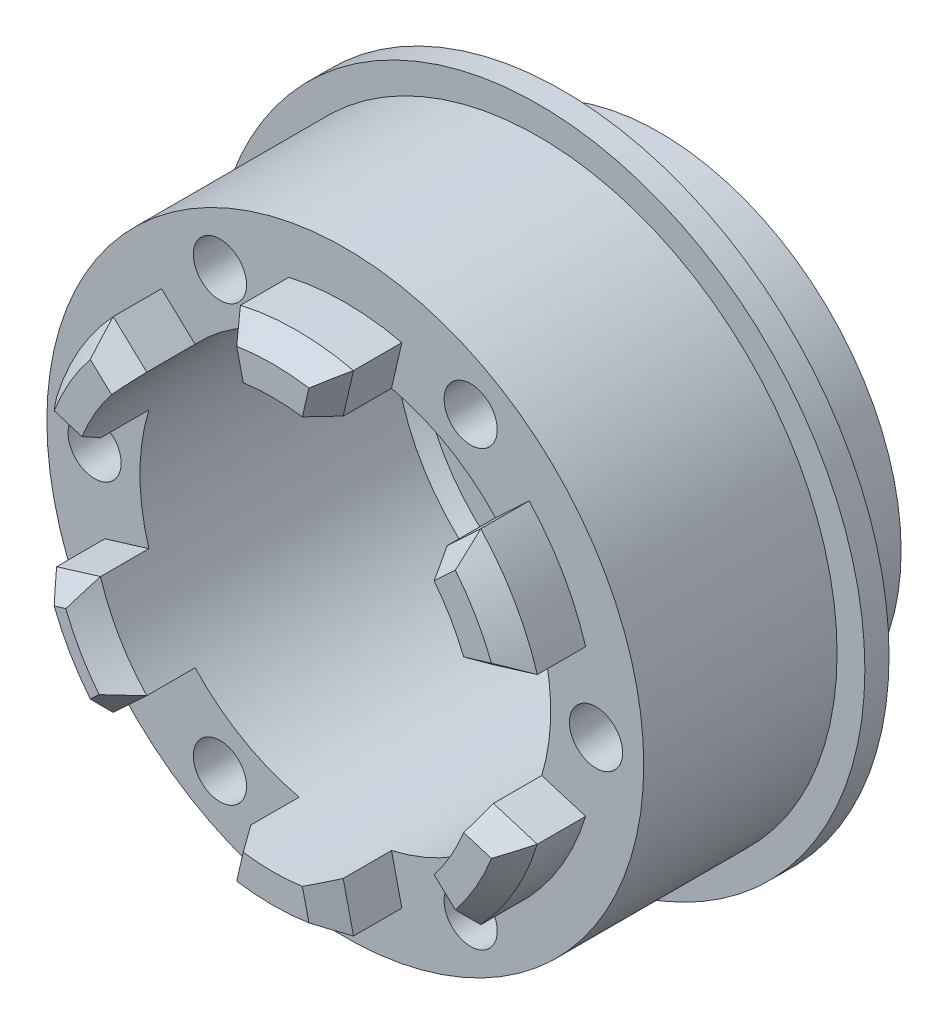
from build123d import *
from OCP.BRepFilletAPI import BRepFilletAPI_MakeChamfer
from build123d.topology import SkipClean

# Parameters (mm, degrees)
SKETCH_1_R          = 10
EXTRUDE_1_DEPTH     = 2
SKETCH_2_R          = 10
SKETCH_2_R_2        = 8.5
EXTRUDE_2_DEPTH     = 2
SKETCH_4_R          = 13.5
SKETCH_4_R_2        = 8.5
EXTRUDE_3_DEPTH     = 1
SKETCH_5_R          = 12.35
SKETCH_5_R_2        = 8.5
EXTRUDE_4_DEPTH     = 8
SKETCH_6_R          = 1.1
CUT_EXTRUDE_1_DEPTH = 8
SKETCH_7_R          = 3
SKETCH_7_R_2        = 1.15
CUT_EXTRUDE_2_DEPTH = 24.097618925
EXTRUDE_5_DEPTH     = 3
CHAMFER_1_SIZE      = 1
CHAMFER_1_SIZE2     = 0.700207538
CHAMFER_2_SIZE      = 0.5


with BuildPart() as part:
    # 스케치1 → 보스-돌출1 (new body)
    with BuildSketch(Plane.XY):
        Circle(SKETCH_1_R)
    extrude(amount=EXTRUDE_1_DEPTH)

    # 스케치2 → 보스-돌출2 (add)
    with BuildSketch(Plane.XY.offset(2)):
        Circle(SKETCH_2_R)
        Circle(SKETCH_2_R_2, mode=Mode.SUBTRACT)
    extrude(amount=EXTRUDE_2_DEPTH)

    # 스케치4 → 보스-돌출3 (add)
    with BuildSketch(Plane.XY.offset(4)):
        Circle(SKETCH_4_R)
        Circle(SKETCH_4_R_2, mode=Mode.SUBTRACT)
    extrude(amount=EXTRUDE_3_DEPTH)

    # 스케치5 → 보스-돌출4 (add)
    with BuildSketch(Plane.XY.offset(5)):
        Circle(SKETCH_5_R)
        Circle(SKETCH_5_R_2, mode=Mode.SUBTRACT)
    extrude(amount=EXTRUDE_4_DEPTH)

    # 스케치6 → 컷-돌출1 (cut)
    with BuildSketch(Plane.XY.offset(13)):
        with Locations((10.375, 0)):
            Circle(SKETCH_6_R)
        with Locations((5.1875, -8.985013564)):
            Circle(SKETCH_6_R)
        with Locations((-5.1875, -8.985013564)):
            Circle(SKETCH_6_R)
        with Locations((-10.375, 0)):
            Circle(SKETCH_6_R)
        with Locations((-5.1875, 8.985013564)):
            Circle(SKETCH_6_R)
        with Locations((5.1875, 8.985013564)):
            Circle(SKETCH_6_R)
    extrude(amount=-CUT_EXTRUDE_1_DEPTH, mode=Mode.SUBTRACT)

    # 스케치7 → 컷-돌출2 (cut, through all)
    with BuildSketch(Plane(origin=(0, 0, 0), x_dir=(-1, 0, 0), z_dir=(0, 0, -1))):
        Circle(SKETCH_7_R)
        with Locations((-7, 0)):
            Circle(SKETCH_7_R_2)
        with Locations((7, 0)):
            Circle(SKETCH_7_R_2)
        with Locations((0, 7)):
            Circle(SKETCH_7_R_2)
        with Locations((0, -7)):
            Circle(SKETCH_7_R_2)
    extrude(amount=-CUT_EXTRUDE_2_DEPTH, mode=Mode.SUBTRACT)

    # 스케치10 → 보스-돌출5 (add)
    with SkipClean():  # the faces are left unmerged after this step: merging them gives an invalid solid
        with BuildSketch(Plane.XY.offset(13)):
            with BuildLine():
                Line((2.339490965, 10.133448674), (1.912083962, 8.282145551))
                ThreePointArc((1.912083962, 8.282145551), (0, 8.5), (-1.912083962, 8.282145551))
                Line((-1.912083962, 8.282145551), (-2.339490965, 10.133448674))
                ThreePointArc((-2.339490965, 10.133448674), (0, 10.4), (2.339490965, 10.133448674))
            make_face()
            with BuildLine():
                Line((7.606078497, 7.092782945), (6.216506464, 5.796986061))
                ThreePointArc((6.216506464, 5.796986061), (7.361215932, 4.25), (8.128590426, 2.48515949))
                Line((8.128590426, 2.48515949), (9.945569462, 3.040665729))
                ThreePointArc((9.945569462, 3.040665729), (9.006664199, 5.2), (7.606078497, 7.092782945))
            make_face()
            with BuildLine():
                Line((9.945569462, -3.040665729), (8.128590426, -2.48515949))
                ThreePointArc((8.128590426, -2.48515949), (7.361215932, -4.25), (6.216506464, -5.796986061))
                Line((6.216506464, -5.796986061), (7.606078497, -7.092782945))
                ThreePointArc((7.606078497, -7.092782945), (9.006664199, -5.2), (9.945569462, -3.040665729))
            make_face()
            with BuildLine():
                Line((2.339490965, -10.133448674), (1.912083962, -8.282145551))
                ThreePointArc((1.912083962, -8.282145551), (0, -8.5), (-1.912083962, -8.282145551))
                Line((-1.912083962, -8.282145551), (-2.339490965, -10.133448674))
                ThreePointArc((-2.339490965, -10.133448674), (0, -10.4), (2.339490965, -10.133448674))
            make_face()
            with BuildLine():
                Line((-7.606078497, -7.092782945), (-6.216506464, -5.796986061))
                ThreePointArc((-6.216506464, -5.796986061), (-7.361215932, -4.25), (-8.128590426, -2.48515949))
                Line((-8.128590426, -2.48515949), (-9.945569462, -3.040665729))
                ThreePointArc((-9.945569462, -3.040665729), (-9.006664199, -5.2), (-7.606078497, -7.092782945))
            make_face()
            with BuildLine():
                Line((-9.945569462, 3.040665729), (-8.128590426, 2.48515949))
                ThreePointArc((-8.128590426, 2.48515949), (-7.361215932, 4.25), (-6.216506464, 5.796986061))
                Line((-6.216506464, 5.796986061), (-7.606078497, 7.092782945))
                ThreePointArc((-7.606078497, 7.092782945), (-9.006664199, 5.2), (-9.945569462, 3.040665729))
            make_face()
        extrude(amount=EXTRUDE_5_DEPTH)

    # 모따기1: one chamfer whose edges measure the first distance from different faces: ONE call of the kernel's chamfer builder (chamfer() names one face for all edges)
    chamfer_1_edges_1 = [part.edges().sort_by_distance(p)[0] for p in [
        (-9.006664199, -5.2, 16),
    ]]
    chamfer_1_side_1 = [part.faces().sort_by_distance(p)[0] for p in [
        (-9.006664199, -5.2, 14.5),
    ]]
    chamfer_1_edges_2 = [part.edges().sort_by_distance(p)[0] for p in [
        (0, -10.4, 16),
    ]]
    chamfer_1_side_2 = [part.faces().sort_by_distance(p)[0] for p in [
        (0, -10.4, 14.5),
    ]]
    chamfer_1_edges_3 = [part.edges().sort_by_distance(p)[0] for p in [
        (9.006664199, -5.2, 16),
    ]]
    chamfer_1_side_3 = [part.faces().sort_by_distance(p)[0] for p in [
        (9.006664199, -5.2, 14.5),
    ]]
    chamfer_1_edges_4 = [part.edges().sort_by_distance(p)[0] for p in [
        (9.006664199, 5.2, 16),
    ]]
    chamfer_1_side_4 = [part.faces().sort_by_distance(p)[0] for p in [
        (9.006664199, 5.2, 14.5),
    ]]
    chamfer_1_edges_5 = [part.edges().sort_by_distance(p)[0] for p in [
        (0, 10.4, 16),
    ]]
    chamfer_1_side_5 = [part.faces().sort_by_distance(p)[0] for p in [
        (0, 10.4, 14.5),
    ]]
    chamfer_1_edges_6 = [part.edges().sort_by_distance(p)[0] for p in [
        (-9.006664199, 5.2, 16),
    ]]
    chamfer_1_side_6 = [part.faces().sort_by_distance(p)[0] for p in [
        (-9.006664199, 5.2, 14.5),
    ]]
    chamfer_1_edges_7 = [part.edges().sort_by_distance(p)[0] for p in [
        (-9.037079944, -2.76291261, 16),
    ]]
    chamfer_1_side_7 = [part.faces().sort_by_distance(p)[0] for p in [
        (-9.037079944, -2.76291261, 14.5),
    ]]
    chamfer_1_edges_8 = [part.edges().sort_by_distance(p)[0] for p in [
        (-7.361215932, -4.25, 16),
    ]]
    chamfer_1_side_8 = [part.faces().sort_by_distance(p)[0] for p in [
        (-7.361215932, -4.25, 14.5),
    ]]
    chamfer_1_edges_9 = [part.edges().sort_by_distance(p)[0] for p in [
        (-6.91129248, -6.444884503, 16),
    ]]
    chamfer_1_side_9 = [part.faces().sort_by_distance(p)[0] for p in [
        (-6.91129248, -6.444884503, 14.5),
    ]]
    chamfer_1_edges_10 = [part.edges().sort_by_distance(p)[0] for p in [
        (2.125787464, -9.207797112, 16),
    ]]
    chamfer_1_side_10 = [part.faces().sort_by_distance(p)[0] for p in [
        (2.125787464, -9.207797112, 14.5),
    ]]
    chamfer_1_edges_11 = [part.edges().sort_by_distance(p)[0] for p in [
        (-2.125787464, -9.207797112, 16),
    ]]
    chamfer_1_side_11 = [part.faces().sort_by_distance(p)[0] for p in [
        (-2.125787464, -9.207797112, 14.5),
    ]]
    chamfer_1_edges_12 = [part.edges().sort_by_distance(p)[0] for p in [
        (6.91129248, -6.444884503, 16),
    ]]
    chamfer_1_side_12 = [part.faces().sort_by_distance(p)[0] for p in [
        (6.91129248, -6.444884503, 14.5),
    ]]
    chamfer_1_edges_13 = [part.edges().sort_by_distance(p)[0] for p in [
        (9.037079944, -2.76291261, 16),
    ]]
    chamfer_1_side_13 = [part.faces().sort_by_distance(p)[0] for p in [
        (9.037079944, -2.76291261, 14.5),
    ]]
    chamfer_1_edges_14 = [part.edges().sort_by_distance(p)[0] for p in [
        (9.037079944, 2.76291261, 16),
    ]]
    chamfer_1_side_14 = [part.faces().sort_by_distance(p)[0] for p in [
        (9.037079944, 2.76291261, 14.5),
    ]]
    chamfer_1_edges_15 = [part.edges().sort_by_distance(p)[0] for p in [
        (6.91129248, 6.444884503, 16),
    ]]
    chamfer_1_side_15 = [part.faces().sort_by_distance(p)[0] for p in [
        (6.91129248, 6.444884503, 14.5),
    ]]
    chamfer_1_edges_16 = [part.edges().sort_by_distance(p)[0] for p in [
        (2.125787464, 9.207797112, 16),
    ]]
    chamfer_1_side_16 = [part.faces().sort_by_distance(p)[0] for p in [
        (2.125787464, 9.207797112, 14.5),
    ]]
    chamfer_1_edges_17 = [part.edges().sort_by_distance(p)[0] for p in [
        (-2.125787464, 9.207797112, 16),
    ]]
    chamfer_1_side_17 = [part.faces().sort_by_distance(p)[0] for p in [
        (-2.125787464, 9.207797112, 14.5),
    ]]
    chamfer_1_edges_18 = [part.edges().sort_by_distance(p)[0] for p in [
        (-9.037079944, 2.76291261, 16),
    ]]
    chamfer_1_side_18 = [part.faces().sort_by_distance(p)[0] for p in [
        (-9.037079944, 2.76291261, 14.5),
    ]]
    chamfer_1_edges_19 = [part.edges().sort_by_distance(p)[0] for p in [
        (-6.91129248, 6.444884503, 16),
    ]]
    chamfer_1_side_19 = [part.faces().sort_by_distance(p)[0] for p in [
        (-6.91129248, 6.444884503, 14.5),
    ]]
    chamfer_1 = BRepFilletAPI_MakeChamfer(part.part.solid().wrapped)
    for e in chamfer_1_edges_1:
        chamfer_1.Add(CHAMFER_1_SIZE, CHAMFER_1_SIZE2, e.wrapped, chamfer_1_side_1[0].wrapped)  # the first distance lies on this face
    for e in chamfer_1_edges_2:
        chamfer_1.Add(CHAMFER_1_SIZE, CHAMFER_1_SIZE2, e.wrapped, chamfer_1_side_2[0].wrapped)  # the first distance lies on this face
    for e in chamfer_1_edges_3:
        chamfer_1.Add(CHAMFER_1_SIZE, CHAMFER_1_SIZE2, e.wrapped, chamfer_1_side_3[0].wrapped)  # the first distance lies on this face
    for e in chamfer_1_edges_4:
        chamfer_1.Add(CHAMFER_1_SIZE, CHAMFER_1_SIZE2, e.wrapped, chamfer_1_side_4[0].wrapped)  # the first distance lies on this face
    for e in chamfer_1_edges_5:
        chamfer_1.Add(CHAMFER_1_SIZE, CHAMFER_1_SIZE2, e.wrapped, chamfer_1_side_5[0].wrapped)  # the first distance lies on this face
    for e in chamfer_1_edges_6:
        chamfer_1.Add(CHAMFER_1_SIZE, CHAMFER_1_SIZE2, e.wrapped, chamfer_1_side_6[0].wrapped)  # the first distance lies on this face
    for e in chamfer_1_edges_7:
        chamfer_1.Add(CHAMFER_1_SIZE, CHAMFER_1_SIZE2, e.wrapped, chamfer_1_side_7[0].wrapped)  # the first distance lies on this face
    for e in chamfer_1_edges_8:
        chamfer_1.Add(CHAMFER_1_SIZE, CHAMFER_1_SIZE2, e.wrapped, chamfer_1_side_8[0].wrapped)  # the first distance lies on this face
    for e in chamfer_1_edges_9:
        chamfer_1.Add(CHAMFER_1_SIZE, CHAMFER_1_SIZE2, e.wrapped, chamfer_1_side_9[0].wrapped)  # the first distance lies on this face
    for e in chamfer_1_edges_10:
        chamfer_1.Add(CHAMFER_1_SIZE, CHAMFER_1_SIZE2, e.wrapped, chamfer_1_side_10[0].wrapped)  # the first distance lies on this face
    for e in chamfer_1_edges_11:
        chamfer_1.Add(CHAMFER_1_SIZE, CHAMFER_1_SIZE2, e.wrapped, chamfer_1_side_11[0].wrapped)  # the first distance lies on this face
    for e in chamfer_1_edges_12:
        chamfer_1.Add(CHAMFER_1_SIZE, CHAMFER_1_SIZE2, e.wrapped, chamfer_1_side_12[0].wrapped)  # the first distance lies on this face
    for e in chamfer_1_edges_13:
        chamfer_1.Add(CHAMFER_1_SIZE, CHAMFER_1_SIZE2, e.wrapped, chamfer_1_side_13[0].wrapped)  # the first distance lies on this face
    for e in chamfer_1_edges_14:
        chamfer_1.Add(CHAMFER_1_SIZE, CHAMFER_1_SIZE2, e.wrapped, chamfer_1_side_14[0].wrapped)  # the first distance lies on this face
    for e in chamfer_1_edges_15:
        chamfer_1.Add(CHAMFER_1_SIZE, CHAMFER_1_SIZE2, e.wrapped, chamfer_1_side_15[0].wrapped)  # the first distance lies on this face
    for e in chamfer_1_edges_16:
        chamfer_1.Add(CHAMFER_1_SIZE, CHAMFER_1_SIZE2, e.wrapped, chamfer_1_side_16[0].wrapped)  # the first distance lies on this face
    for e in chamfer_1_edges_17:
        chamfer_1.Add(CHAMFER_1_SIZE, CHAMFER_1_SIZE2, e.wrapped, chamfer_1_side_17[0].wrapped)  # the first distance lies on this face
    for e in chamfer_1_edges_18:
        chamfer_1.Add(CHAMFER_1_SIZE, CHAMFER_1_SIZE2, e.wrapped, chamfer_1_side_18[0].wrapped)  # the first distance lies on this face
    for e in chamfer_1_edges_19:
        chamfer_1.Add(CHAMFER_1_SIZE, CHAMFER_1_SIZE2, e.wrapped, chamfer_1_side_19[0].wrapped)  # the first distance lies on this face
    add(Compound.cast(chamfer_1.Shape()), mode=Mode.REPLACE)

    # 모따기2
    # the kernel refuses this chamfer: 0.5 mm, written as the material it adds along each edge
    with BuildSketch(Plane(origin=(0, 0, 2), x_dir=(1, 0, 0), z_dir=(0, -1, 0))) as chamfer_2_piece_1_section:
        Polygon((8.5, CHAMFER_2_SIZE), (8.5 - CHAMFER_2_SIZE, 0), (8.5, 0), align=None)
    chamfer_2_piece_1 = revolve(axis=Axis((0, 0, 2), (0, 0, 1)), mode=Mode.PRIVATE)
    chamfer_2_piece_1 = chamfer_2_piece_1 - Plane(origin=(0, -7, 2.236368943), x_dir=(-1, 0, 0), z_dir=(0, 0, -1)) * Cylinder(1.15, 34, mode=Mode.PRIVATE)
    chamfer_2_piece_1 = chamfer_2_piece_1 - Plane(origin=(-7, 0, 2.236368943), x_dir=(-1, 0, 0), z_dir=(0, 0, -1)) * Cylinder(1.15, 34, mode=Mode.PRIVATE)
    chamfer_2_piece_1 = chamfer_2_piece_1 - Plane(origin=(7, 0, 2.236368943), x_dir=(-1, 0, 0), z_dir=(0, 0, -1)) * Cylinder(1.15, 34, mode=Mode.PRIVATE)
    chamfer_2_piece_1 = chamfer_2_piece_1 - Plane(origin=(0, 7, 2.236368943), x_dir=(-1, 0, 0), z_dir=(0, 0, -1)) * Cylinder(1.15, 34, mode=Mode.PRIVATE)
    add(chamfer_2_piece_1)


solid = part.part
